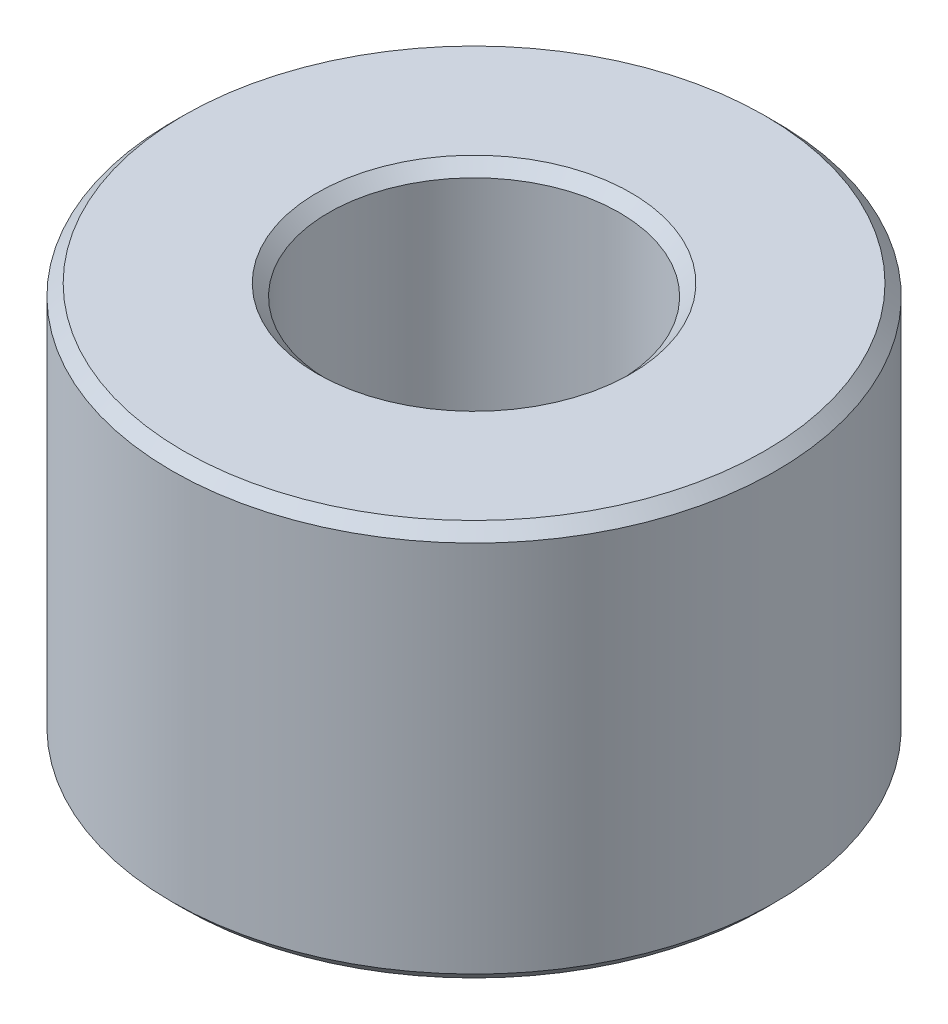
from build123d import *

# Parameters (mm, degrees)
SKETCH1_R           = 27.5
BOSS_EXTRUDE1_DEPTH = 36.070528851
SKETCH2_R           = 13.236107378
CUT_EXTRUDE1_DEPTH  = 54.043218715
CHAMFER1_SIZE       = 1.045240589


with BuildPart() as part:
    # Sketch1 → Boss-Extrude1 (new body)
    with BuildSketch(Plane(origin=(0, 0, 0), x_dir=(1, 0, 0), z_dir=(0, 1, 0))):
        Circle(SKETCH1_R)
    extrude(amount=BOSS_EXTRUDE1_DEPTH)

    # Sketch2 → Cut-Extrude1 (cut, through all)
    with BuildSketch(Plane(origin=(0, 0, 0), x_dir=(1, 0, 0), z_dir=(0, 1, 0))):
        Circle(SKETCH2_R)
    extrude(amount=CUT_EXTRUDE1_DEPTH, mode=Mode.SUBTRACT)

    # Chamfer1
    chamfer1_edges = [part.edges().sort_by_distance(p)[0] for p in [
        (-13.236107378, 36.070528851, 0),
        (-13.236107378, 0, 0),
        (-27.5, 0, 0),
        (-27.5, 36.070528851, 0),
    ]]
    chamfer(chamfer1_edges, length=CHAMFER1_SIZE)


solid = part.part
